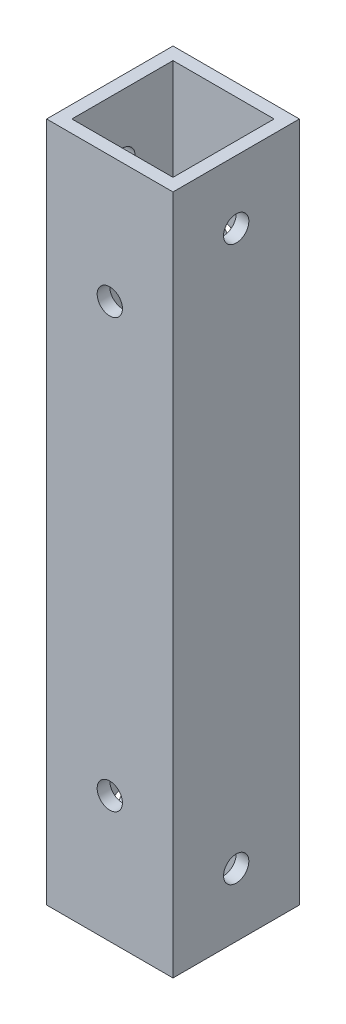
from build123d import *

# Parameters (mm, degrees)
SKETCH1_W              = 15
SKETCH1_H              = 15
SKETCH1_W_2            = 12
SKETCH1_H_2            = 12
EXTRUDE_THIN1_DEPTH    = 80.79
CUT_EXTRUDE1_OUTLINE_R = 1.5
CUT_EXTRUDE1_DEPTH     = 15
SKETCH3_R              = 1.5
CUT_EXTRUDE2_DEPTH     = 84.528582533


# Read off the part's stored shape, not the designer's step: Cut-Extrude1
with BuildPart() as part:
    # Sketch1 → Extrude-Thin1 (new body)
    with BuildSketch(Plane(origin=(0, 0, 0), x_dir=(1, 0, 0), z_dir=(0, 1, 0))):
        with Locations((7.5, 7.5)):
            Rectangle(SKETCH1_W, SKETCH1_H)
        with Locations((7.5, 7.5)):
            Rectangle(SKETCH1_W_2, SKETCH1_H_2, mode=Mode.SUBTRACT)
    extrude(amount=EXTRUDE_THIN1_DEPTH)

    # Cut-Extrude1 outline → Cut-Extrude1 (cut)
    with BuildSketch(Plane.YZ):
        with Locations((73.291264227, -7.5)):
            Circle(CUT_EXTRUDE1_OUTLINE_R)
        with Locations((7.501264227, -7.5)):
            Circle(CUT_EXTRUDE1_OUTLINE_R)
    extrude(amount=CUT_EXTRUDE1_DEPTH, mode=Mode.SUBTRACT)

    # Sketch3 → Cut-Extrude2 (cut, through all)
    with BuildSketch(Plane.XY):
        with Locations((7.5, 15)):
            Circle(SKETCH3_R)
        with Locations((7.5, 65.79)):
            Circle(SKETCH3_R)
    extrude(amount=-CUT_EXTRUDE2_DEPTH, mode=Mode.SUBTRACT)


solid = part.part
